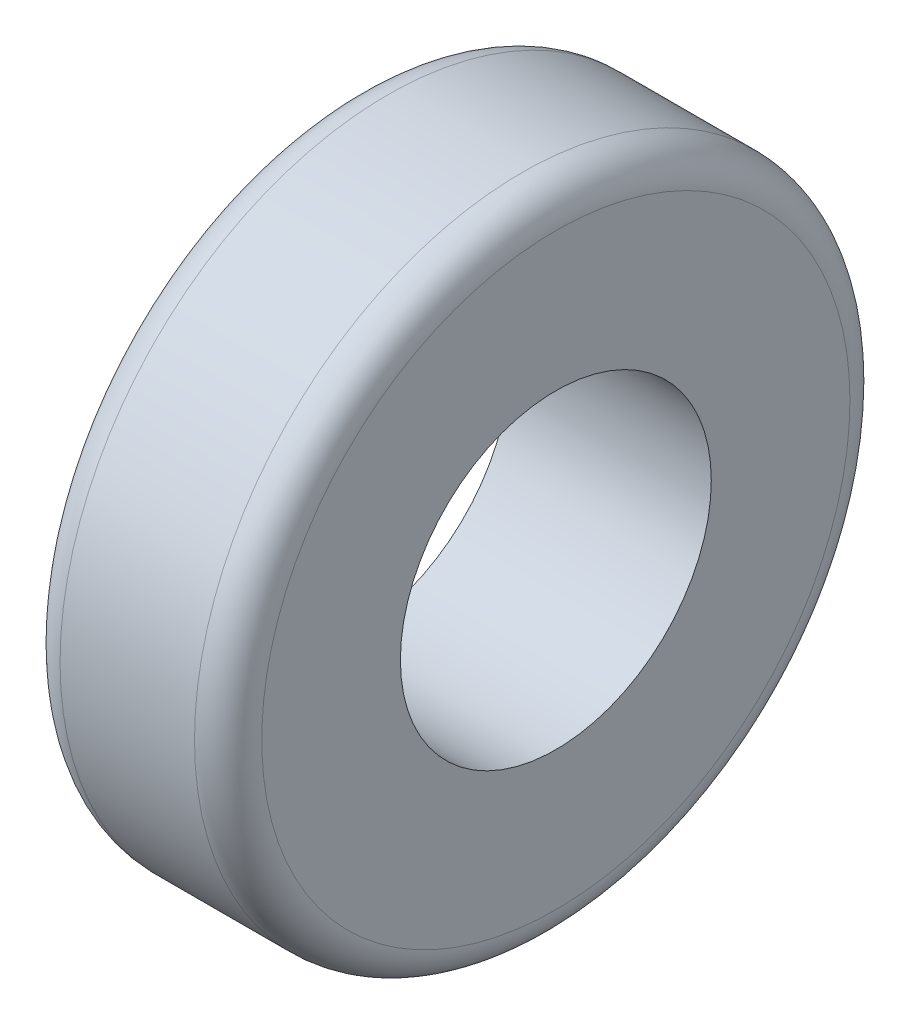
from build123d import *

# Parameters (mm, degrees)
SKETCH1_R           = 123.825
SKETCH1_R_2         = 58.7375
BOSS_EXTRUDE1_DEPTH = 76.2
FILLET1_R           = 12.7


with BuildPart() as part:
    # Sketch1 → Boss-Extrude1 (new body)
    with BuildSketch(Plane(origin=(0, 0, 0), x_dir=(0, 0, -1), z_dir=(1, 0, 0))):
        with Locations((-57.8669729, 49.771579403)):
            Circle(SKETCH1_R)
        with Locations((-57.8669729, 49.771579403)):
            Circle(SKETCH1_R_2, mode=Mode.SUBTRACT)
    extrude(amount=BOSS_EXTRUDE1_DEPTH)

    # Fillet1
    fillet1_edges = [part.edges().sort_by_distance(p)[0] for p in [
        (0, 49.771579403, 181.6919729),
        (76.2, 49.771579403, 181.6919729),
    ]]
    fillet(fillet1_edges, radius=FILLET1_R)


solid = part.part
